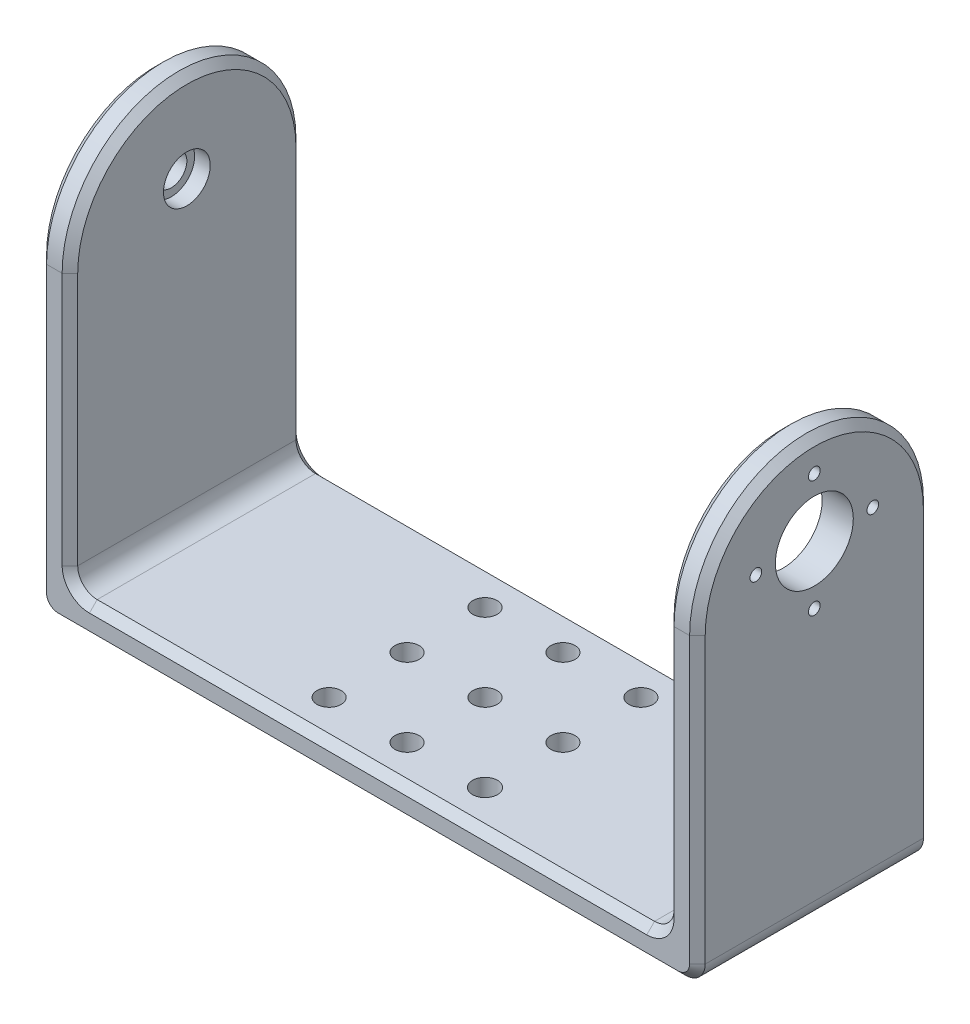
from build123d import *

# Parameters (mm, degrees)
SKETCH1_W           = 169
SKETCH1_H           = 60
BOSS_EXTRUDE1_DEPTH = 8
SKETCH2_W           = 8
SKETCH2_H           = 60
BOSS_EXTRUDE2_DEPTH = 100
SKETCH3_R           = 10
SKETCH3_R_2         = 1.5
CUT_EXTRUDE1_DEPTH  = 12
SKETCH5_R           = 5
BOSS_EXTRUDE3_DEPTH = 1.5
SKETCH6_R           = 4
CUT_EXTRUDE3_DEPTH  = 15
SKETCH7_R           = 6
CUT_EXTRUDE4_DEPTH  = 4
FILLET1_RADIUS      = 30
FILLET1_LENGTH      = 8
FILLET2_RADIUS      = 30
FILLET2_LENGTH      = 8
FILLET3_R           = 5
FILLET4_R           = 5
FILLET5_R           = 5
FILLET6_R           = 5
CHAMFER1_SIZE       = 2
SKETCH8_R           = 3.1
SKETCH8_R_2         = 3.2
CUT_EXTRUDE5_DEPTH  = 10


with BuildPart() as part:
    # Sketch1 → Boss-Extrude1 (new body)
    with BuildSketch(Plane(origin=(0, 0, 0), x_dir=(1, 0, 0), z_dir=(0, 1, 0))):
        Rectangle(SKETCH1_W, SKETCH1_H)
    extrude(amount=BOSS_EXTRUDE1_DEPTH)

    # Sketch2 → Boss-Extrude2 (add)
    with BuildSketch(Plane(origin=(0, 8, 0), x_dir=(1, 0, 0), z_dir=(0, 1, 0))):
        with Locations((-80.5, 0)):
            Rectangle(SKETCH2_W, SKETCH2_H)
        with Locations((80.5, 0)):
            Rectangle(SKETCH2_W, SKETCH2_H)
    extrude(amount=BOSS_EXTRUDE2_DEPTH)

    # Sketch3 → Cut-Extrude1 (cut)
    with BuildSketch(Plane(origin=(84.5, 0, 0), x_dir=(0, 0, -1), z_dir=(1, 0, 0))):
        with Locations((0, 85)):
            Circle(SKETCH3_R)
        with Locations((0, 70)):
            Circle(SKETCH3_R_2)
        with Locations((0, 100)):
            Circle(SKETCH3_R_2)
        with Locations((-15, 85)):
            Circle(SKETCH3_R_2)
        with Locations((15, 85)):
            Circle(SKETCH3_R_2)
    extrude(amount=-CUT_EXTRUDE1_DEPTH, mode=Mode.SUBTRACT)

    # Sketch5 → Boss-Extrude3 (add)
    with BuildSketch(Plane.ZY.offset(84.5)):
        with Locations(Location((0, 85, 0), (0, 0, 180))):
            Circle(SKETCH5_R)
    extrude(amount=BOSS_EXTRUDE3_DEPTH)

    # Sketch6 → Cut-Extrude3 (cut)
    with BuildSketch(Plane.ZY.offset(86)):
        with Locations((0, 85)):
            Circle(SKETCH6_R)
    extrude(amount=-CUT_EXTRUDE3_DEPTH, mode=Mode.SUBTRACT)

    # Sketch7 → Cut-Extrude4 (cut)
    with BuildSketch(Plane(origin=(-76.5, 0, 0), x_dir=(0, 0, -1), z_dir=(1, 0, 0))):
        with Locations((0, 85)):
            Circle(SKETCH7_R)
    extrude(amount=-CUT_EXTRUDE4_DEPTH, mode=Mode.SUBTRACT)

    # Fillet1: full round fillet: the end face becomes a half cylinder, R = half its width
    fillet1_face = Plane((80.5, 108, 0), x_dir=(-1, 0, 0), z_dir=(0, 1, 0))  # on the end face: x along it, z out of the body
    fillet1_slab = fillet1_face.offset(-FILLET1_RADIUS / 2) * Box(FILLET1_LENGTH, 2 * FILLET1_RADIUS, FILLET1_RADIUS, mode=Mode.PRIVATE)  # the body's end, R deep
    fillet1_round = Plane((80.5, 78, 0), x_dir=(0, 1, 0), z_dir=(-1, 0, 0)) * Cylinder(FILLET1_RADIUS, FILLET1_LENGTH, mode=Mode.PRIVATE)  # its axis R under the face
    add(fillet1_slab - fillet1_round, mode=Mode.SUBTRACT)

    # Fillet2: full round fillet: the end face becomes a half cylinder, R = half its width
    fillet2_face = Plane((-80.5, 108, 0), x_dir=(1, 0, 0), z_dir=(0, 1, 0))  # on the end face: x along it, z out of the body
    fillet2_slab = fillet2_face.offset(-FILLET2_RADIUS / 2) * Box(FILLET2_LENGTH, 2 * FILLET2_RADIUS, FILLET2_RADIUS, mode=Mode.PRIVATE)  # the body's end, R deep
    fillet2_round = Plane((-80.5, 78, 0), x_dir=(0, 1, 0), z_dir=(1, 0, 0)) * Cylinder(FILLET2_RADIUS, FILLET2_LENGTH, mode=Mode.PRIVATE)  # its axis R under the face
    add(fillet2_slab - fillet2_round, mode=Mode.SUBTRACT)

    # Fillet3
    fillet3_edges = [part.edges().sort_by_distance(p)[0] for p in [
        (76.5, 8, 0),
    ]]
    fillet(fillet3_edges, radius=FILLET3_R)

    # Fillet4
    fillet4_edges = [part.edges().sort_by_distance(p)[0] for p in [
        (-76.5, 8, 0),
    ]]
    fillet(fillet4_edges, radius=FILLET4_R)

    # Fillet5
    fillet5_edges = [part.edges().sort_by_distance(p)[0] for p in [
        (84.5, 0, 0),
    ]]
    fillet(fillet5_edges, radius=FILLET5_R)

    # Fillet6
    fillet6_edges = [part.edges().sort_by_distance(p)[0] for p in [
        (-84.5, 0, 0),
    ]]
    fillet(fillet6_edges, radius=FILLET6_R)

    # Chamfer1
    chamfer1_edges = [part.edges().sort_by_distance(p)[0] for p in [
        (75.035533906, 9.464466094, -30),
        (75.035533906, 9.464466094, 30),
        (0, 8, 30),
        (-75.035533906, 9.464466094, 30),
        (-75.035533906, 9.464466094, -30),
        (0, 0, -30),
        (83.035533906, 1.464466094, 30),
        (83.035533906, 1.464466094, -30),
        (0, 0, 30),
        (-83.035533906, 1.464466094, -30),
        (-83.035533906, 1.464466094, 30),
        (76.5, 45.5, -30),
        (84.5, 41.5, -30),
        (84.5, 41.5, 30),
        (76.5, 45.5, 30),
        (76.5, 108, 0),
        (84.5, 108, 0),
        (-84.5, 41.5, -30),
        (-76.5, 45.5, -30),
        (-76.5, 45.5, 30),
        (-84.5, 41.5, 30),
        (-84.5, 108, 0),
        (-76.5, 108, 0),
        (0, 8, -30),
    ]]
    chamfer(chamfer1_edges, length=CHAMFER1_SIZE)

    # Sketch8 → Cut-Extrude5 (cut)
    with BuildSketch(Plane(origin=(0, 8, 0), x_dir=(1, 0, 0), z_dir=(0, 1, 0))):
        with Locations(Location((0, 0, 0), (0, 0, 270))):
            Circle(SKETCH8_R)
        with Locations(Location((0, 20, 0), (0, 0, 270))):
            Circle(SKETCH8_R)
        with Locations(Location((0, -20, 0), (0, 0, 270))):
            Circle(SKETCH8_R)
        with Locations(Location((-20, -20, 0), (0, 0, 270))):
            Circle(SKETCH8_R)
        with Locations(Location((-20, 20, 0), (0, 0, 270))):
            Circle(SKETCH8_R)
        with Locations(Location((-20, 0, 0), (0, 0, 270))):
            Circle(SKETCH8_R)
        with Locations(Location((20, -20, 0), (0, 0, 270))):
            Circle(SKETCH8_R_2)
        with Locations(Location((20, 0, 0), (0, 0, 270))):
            Circle(SKETCH8_R)
        with Locations(Location((20, 20, 0), (0, 0, 270))):
            Circle(SKETCH8_R)
    extrude(amount=-CUT_EXTRUDE5_DEPTH, mode=Mode.SUBTRACT)


solid = part.part
